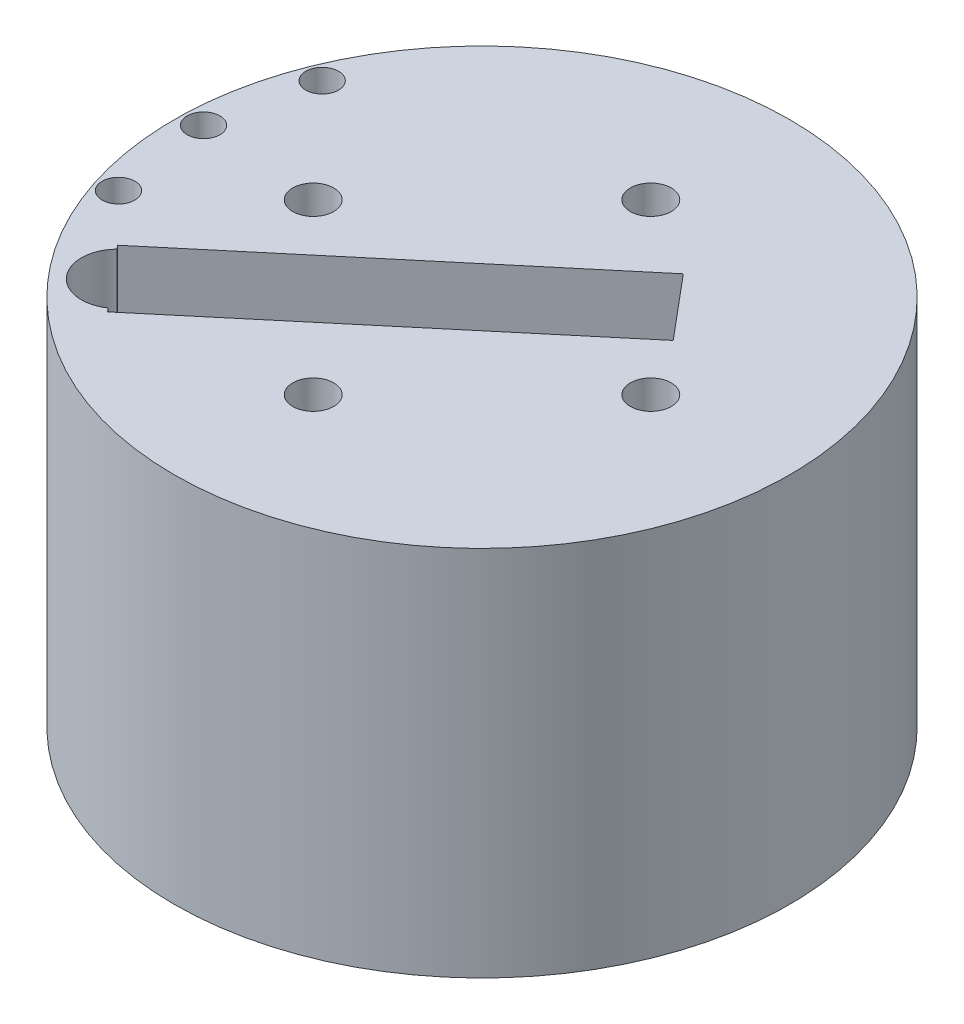
from build123d import *

# Parameters (mm, degrees)
SKETCH2_R           = 47.6885
BOSS_EXTRUDE1_DEPTH = 57.658
SKETCH5_R           = 2.54
SKETCH5_R_2         = 5.6388
CUT_EXTRUDE2_DEPTH  = 89.728975135
SKETCH4_R           = 3.175
CUT_EXTRUDE3_DEPTH  = 89.728975135
CUT_EXTRUDE4_DEPTH  = 43.18
SKETCH11_R          = 6.35
CUT_EXTRUDE7_DEPTH  = 7.62
SKETCH14_R          = 2.067000057
CUT_EXTRUDE8_DEPTH  = 19.05


with BuildPart() as part:
    # Sketch2 → Boss-Extrude1 (new body)
    with BuildSketch(Plane(origin=(0, 0, 0), x_dir=(1, 0, 0), z_dir=(0, 1, 0))):
        Circle(SKETCH2_R)
    extrude(amount=BOSS_EXTRUDE1_DEPTH)

    # Sketch5 → Cut-Extrude2 (cut, through all)
    with BuildSketch(Plane(origin=(0, 57.658, 0), x_dir=(1, 0, 0), z_dir=(0, 1, 0))):
        with Locations((-41.445499463, 16.673368884)):
            Circle(SKETCH5_R)
        with Locations((-44.648658026, 1.492646038)):
            Circle(SKETCH5_R)
        with Locations((-42.466529486, -13.86811195)):
            Circle(SKETCH5_R)
        with Locations((-30.694251769, -25.755535339)):
            Circle(SKETCH5_R_2)
    extrude(amount=-CUT_EXTRUDE2_DEPTH, mode=Mode.SUBTRACT)

    # Sketch4 → Cut-Extrude3 (cut, through all)
    with BuildSketch(Plane(origin=(0, 57.658, 0), x_dir=(1, 0, 0), z_dir=(0, 1, 0))):
        with Locations((-26.162, 0)):
            Circle(SKETCH4_R)
        with Locations((26.162, 0)):
            Circle(SKETCH4_R)
        with Locations((0, 26.162)):
            Circle(SKETCH4_R)
        with Locations((0, -26.162)):
            Circle(SKETCH4_R)
    extrude(amount=-CUT_EXTRUDE3_DEPTH, mode=Mode.SUBTRACT)

    # Sketch6 → Cut-Extrude4 (cut)
    with BuildSketch(Plane(origin=(0, 57.658, 0), x_dir=(1, 0, 0), z_dir=(0, 1, 0))):
        Polygon((-27.050344847, -30.987270671), (20.620600848, 9.013402279), (12.457198205, 18.742166707), (-35.21374749, -21.258506244), align=None)
    extrude(amount=-CUT_EXTRUDE4_DEPTH, mode=Mode.SUBTRACT)

    # Sketch11 → Cut-Extrude7 (cut)
    with BuildSketch(Plane.XZ):
        with Locations((0, 26.162)):
            Circle(SKETCH11_R)
        with Locations((26.162, 0)):
            Circle(SKETCH11_R)
        with Locations((0, -26.162)):
            Circle(SKETCH11_R)
        with Locations((-26.162, 0)):
            Circle(SKETCH11_R)
    extrude(amount=-CUT_EXTRUDE7_DEPTH, mode=Mode.SUBTRACT)

    # Sketch14 → Cut-Extrude8 (cut)
    with BuildSketch(Plane.XZ):
        with Locations((1.356935186, -14.949033782)):
            Circle(SKETCH14_R)
        with Locations((4.523691953, 8.972265338)):
            Circle(SKETCH14_R)
    extrude(amount=-CUT_EXTRUDE8_DEPTH, mode=Mode.SUBTRACT)


solid = part.part
